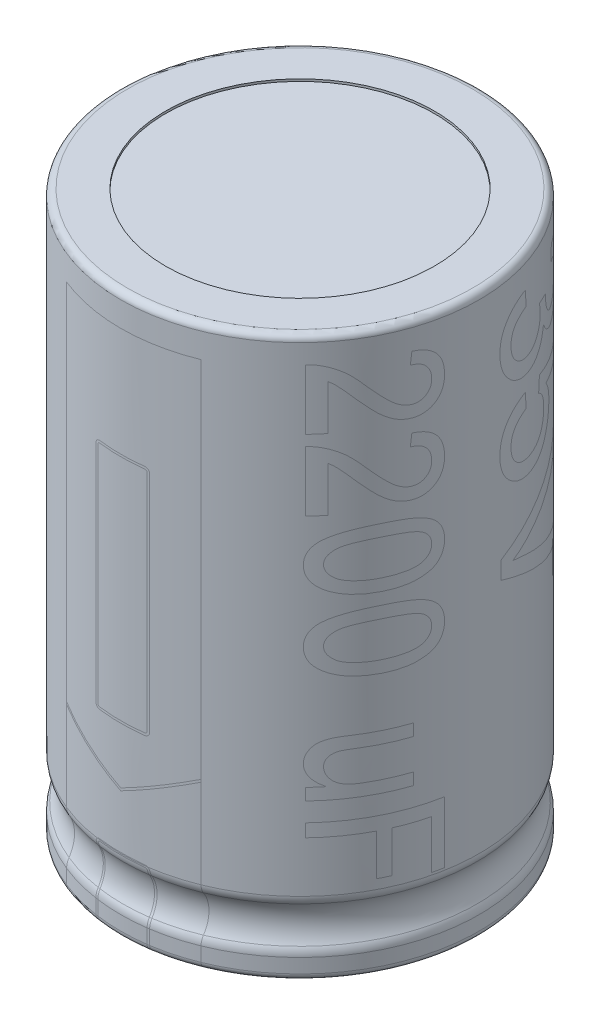
from build123d import *

# Parameters (mm, degrees)
SKETCH1_R           = 8
BOSS_EXTRUDE1_DEPTH = 25
FILLET2_R           = 0.3
FILLET3_R           = 0.3
FILLET4_R           = 0.7
SKETCH3_R           = 6
CUT_EXTRUDE1_DEPTH  = 0.1
CUT_EXTRUDE3_START  = -0.1
SKETCH5_R           = 6
CUT_EXTRUDE3_DEPTH  = 0.1
FILLET5_R           = 0.1


with BuildPart() as part:
    # Sketch1 → Boss-Extrude1 (new body)
    with BuildSketch(Plane(origin=(0, 0, 0), x_dir=(1, 0, 0), z_dir=(0, 1, 0))):
        with Locations(Location((0, 0, 0), (0, 0, 270))):
            Circle(SKETCH1_R)
    extrude(amount=BOSS_EXTRUDE1_DEPTH)

    # Sketch2 → Cut-Revolve1 (revolve, cut)
    with BuildSketch(Plane.XY, mode=Mode.PRIVATE) as cut_revolve1_sk:
        with BuildLine():
            Line((8, 3.081921885), (8, 1.150070232))
            ThreePointArc((8, 1.150070232), (7.672112365, 2.115996058), (8, 3.081921885))
        make_face()
    revolve(cut_revolve1_sk.sketch.rotate(Axis((0, 0, 0), (0, 1, 0)), 90), axis=Axis((0, 0, 0), (0, 1, 0)), mode=Mode.SUBTRACT)

    # Fillet2
    fillet2_edges = [part.edges().sort_by_distance(p)[0] for p in [
        (0, 25, -8),
    ]]
    fillet(fillet2_edges, radius=FILLET2_R)

    # Fillet3
    fillet3_edges = [part.edges().sort_by_distance(p)[0] for p in [
        (0, 0, -8),
    ]]
    fillet(fillet3_edges, radius=FILLET3_R)

    # Fillet4
    fillet4_edges = [part.edges().sort_by_distance(p)[0] for p in [
        (-8, 1.150070232, 0),
        (-8, 3.081921885, 0),
    ]]
    fillet(fillet4_edges, radius=FILLET4_R)

    # Sketch3 → Cut-Extrude1 (cut)
    with BuildSketch(Plane(origin=(0, 25, 0), x_dir=(1, 0, 0), z_dir=(0, 1, 0))):
        with Locations(Location((0, 0, 0), (0, 0, 270))):
            Circle(SKETCH3_R)
    extrude(amount=-CUT_EXTRUDE1_DEPTH, mode=Mode.SUBTRACT)

    # Sketch5 → Cut-Extrude3 (cut)
    with BuildSketch(Plane.XZ.offset(CUT_EXTRUDE3_START)):
        with Locations(Location((0, 0, 0), (0, 0, 90))):
            Circle(SKETCH5_R)
    extrude(amount=CUT_EXTRUDE3_DEPTH, mode=Mode.SUBTRACT)

    # Fillet5
    fillet5_edges = [part.edges().sort_by_distance(p)[0] for p in [
        (0, 0, -6),
    ]]
    fillet(fillet5_edges, radius=FILLET5_R - 0.0001)  # a hair under: the kernel refuses the full size


solid = part.part
